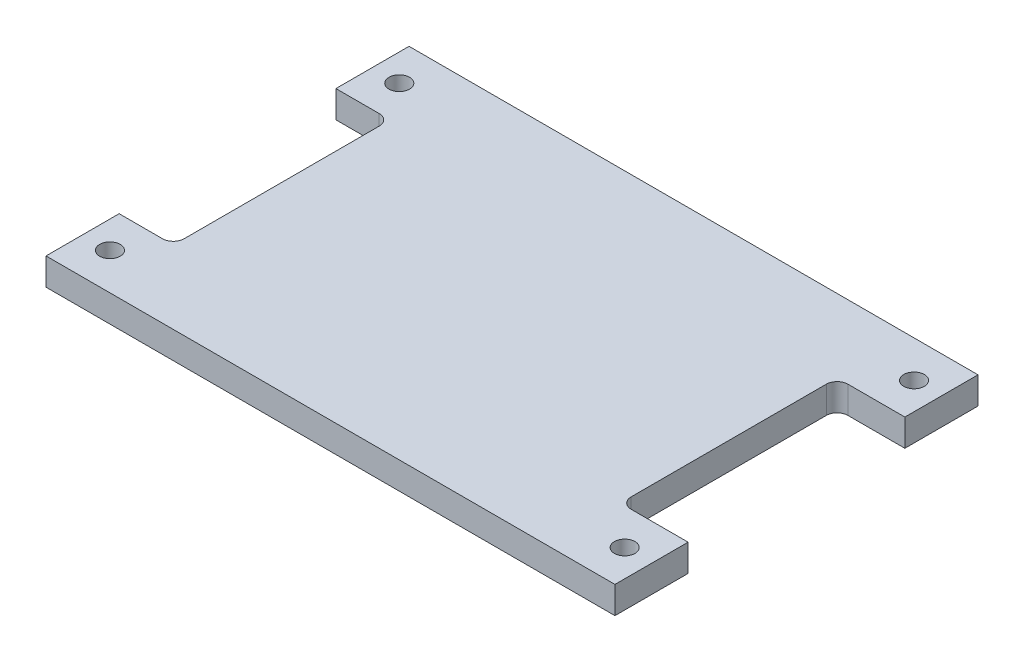
from build123d import *

# Parameters (mm, degrees)
SKETCH1_W           = 133.35
SKETCH1_H           = 85.09
BOSS_EXTRUDE1_DEPTH = 6.35
SKETCH4_W           = 15.875
SKETCH4_H           = 50.8
SKETCH4_W_2         = 12.7
CUT_EXTRUDE8_DEPTH  = 101.417876049
SKETCH2_R           = 2.413
CUT_EXTRUDE1_DEPTH  = 101.417876049
FILLET1_R           = 2.54


with BuildPart() as part:
    # Sketch1 → Boss-Extrude1 (new body)
    with BuildSketch(Plane(origin=(0, 0, 0), x_dir=(1, 0, 0), z_dir=(0, 1, 0))):
        with Locations((21.486627907, 5.109534884)):
            Rectangle(SKETCH1_W, SKETCH1_H)
    extrude(amount=BOSS_EXTRUDE1_DEPTH)

    # Sketch4 → Cut-Extrude8 (cut, through all)
    with BuildSketch(Plane(origin=(0, 6.35, 0), x_dir=(1, 0, 0), z_dir=(0, 1, 0))):
        with Locations((80.224127907, 5.109534884)):
            Rectangle(SKETCH4_W, SKETCH4_H)
        with Locations((-38.838372093, 5.109534884)):
            Rectangle(SKETCH4_W_2, SKETCH4_H)
    extrude(amount=-CUT_EXTRUDE8_DEPTH, mode=Mode.SUBTRACT)

    # Sketch2 → Cut-Extrude1 (cut, through all)
    with BuildSketch(Plane(origin=(0, 6.35, 0), x_dir=(1, 0, 0), z_dir=(0, 1, 0))):
        with Locations((81.811627907, -28.799465116)):
            Circle(SKETCH2_R)
        with Locations((81.811627907, 39.018534884)):
            Circle(SKETCH2_R)
        with Locations((-38.838372093, 39.018534884)):
            Circle(SKETCH2_R)
        with Locations((-38.838372093, -28.799465116)):
            Circle(SKETCH2_R)
    extrude(amount=-CUT_EXTRUDE1_DEPTH, mode=Mode.SUBTRACT)

    # Fillet1
    fillet1_edges = [part.edges().sort_by_distance(p)[0] for p in [
        (72.286627907, 3.175, -30.509534884),
        (72.286627907, 3.175, 20.290465116),
        (-32.488372093, 3.175, 20.290465116),
        (-32.488372093, 3.175, -30.509534884),
    ]]
    fillet(fillet1_edges, radius=FILLET1_R)


solid = part.part
